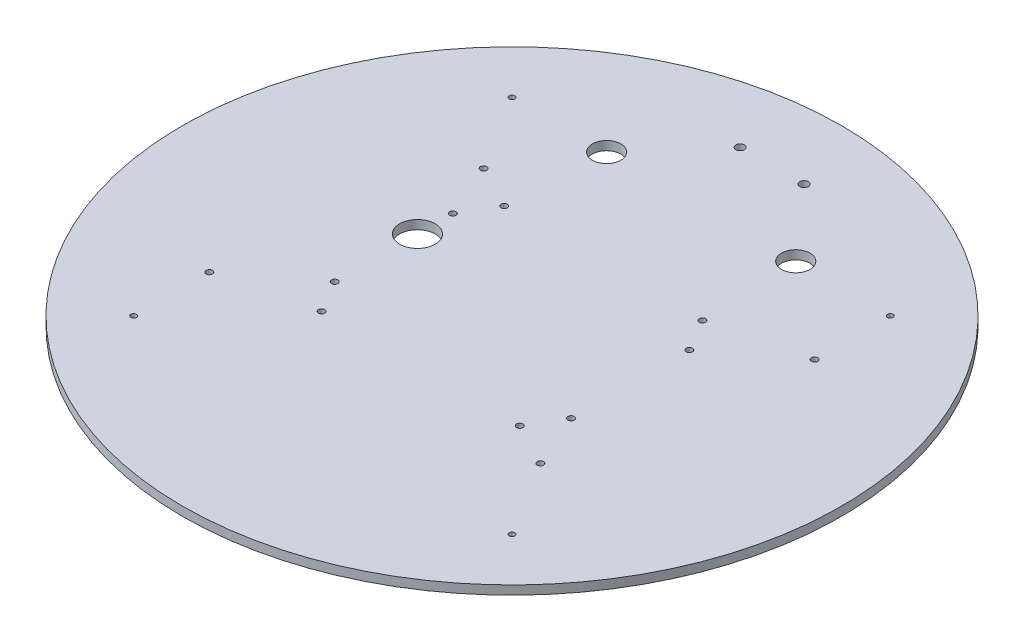
from build123d import *

# Parameters (mm, degrees)
SKETCH1_R            = 177
SKETCH1_R_2          = 1.5
BOSS_EXTRUDE1_DEPTH  = 4.7625
SKETCH2_R            = 1.7
JETSONHOLES_DEPTH    = 251.361102023
SKETCH3_R            = 9.525
UART_WIRE_HOLE_DEPTH = 251.361102023
SKETCH4_R            = 2.286
CAMERA_HOLE_DEPTH    = 251.361102023
SKETCH5_R            = 1.7
STANDOFFHOLES_DEPTH  = 251.361102023
SKETCH6_R            = 1.7
SKETCH6_R_2          = 7.62
NIMH_HOLES_DEPTH     = 251.361102023


with BuildPart() as part:
    # Sketch1 → Boss-Extrude1 (new body)
    with BuildSketch(Plane(origin=(0, 0, 0), x_dir=(1, 0, 0), z_dir=(0, 1, 0))):
        Circle(SKETCH1_R)
        with Locations((-101.6, -101.6)):
            Circle(SKETCH1_R_2, mode=Mode.SUBTRACT)
        with Locations((-101.6, 101.6)):
            Circle(SKETCH1_R_2, mode=Mode.SUBTRACT)
        with Locations((101.6, 101.6)):
            Circle(SKETCH1_R_2, mode=Mode.SUBTRACT)
        with Locations((101.6, -101.6)):
            Circle(SKETCH1_R_2, mode=Mode.SUBTRACT)
    extrude(amount=BOSS_EXTRUDE1_DEPTH)

    # Sketch2 → JetsonHoles (cut, through all)
    with BuildSketch(Plane(origin=(0, 4.7625, 0), x_dir=(1, 0, 0), z_dir=(0, 1, 0))):
        with Locations((-53.213, 49.022)):
            Circle(SKETCH2_R)
        with Locations((53.213, 49.022)):
            Circle(SKETCH2_R)
        with Locations((-53.213, -49.022)):
            Circle(SKETCH2_R)
        with Locations((53.213, -49.022)):
            Circle(SKETCH2_R)
    extrude(amount=-JETSONHOLES_DEPTH, mode=Mode.SUBTRACT)

    # Sketch3 → UART-Wire-Hole (cut, through all)
    with BuildSketch(Plane(origin=(0, 4.7625, 0), x_dir=(1, 0, 0), z_dir=(0, 1, 0))):
        with Locations((-63.5, 12.7)):
            Circle(SKETCH3_R)
    extrude(amount=-UART_WIRE_HOLE_DEPTH, mode=Mode.SUBTRACT)

    # Sketch4 → Camera-Hole (cut, through all)
    with BuildSketch(Plane(origin=(0, 4.7625, 0), x_dir=(1, 0, 0), z_dir=(0, 1, 0))):
        with Locations((-17.145, 139.7)):
            Circle(SKETCH4_R)
        with Locations((17.145, 139.7)):
            Circle(SKETCH4_R)
    extrude(amount=-CAMERA_HOLE_DEPTH, mode=Mode.SUBTRACT)

    # Sketch5 → StandoffHoles (cut, through all)
    with BuildSketch(Plane(origin=(0, 4.7625, 0), x_dir=(1, 0, 0), z_dir=(0, 1, 0))):
        with Locations((-63.5, -31.75)):
            Circle(SKETCH5_R)
        with Locations((63.5, -31.75)):
            Circle(SKETCH5_R)
        with Locations((63.5, 31.75)):
            Circle(SKETCH5_R)
        with Locations((-63.5, 31.75)):
            Circle(SKETCH5_R)
    extrude(amount=-STANDOFFHOLES_DEPTH, mode=Mode.SUBTRACT)

    # Sketch6 → NiMH_Holes (cut, through all)
    with BuildSketch(Plane(origin=(0, 4.7625, 0), x_dir=(1, 0, 0), z_dir=(0, 1, 0))):
        with Locations((101.6, 60.96)):
            Circle(SKETCH6_R)
        with Locations((76.2, -60.96)):
            Circle(SKETCH6_R)
        with Locations((-101.6, -60.96)):
            Circle(SKETCH6_R)
        with Locations((-76.2, 60.96)):
            Circle(SKETCH6_R)
        with Locations((-50.8, 101.6)):
            Circle(SKETCH6_R_2)
        with Locations((50.8, 101.6)):
            Circle(SKETCH6_R_2)
    extrude(amount=-NIMH_HOLES_DEPTH, mode=Mode.SUBTRACT)


solid = part.part
